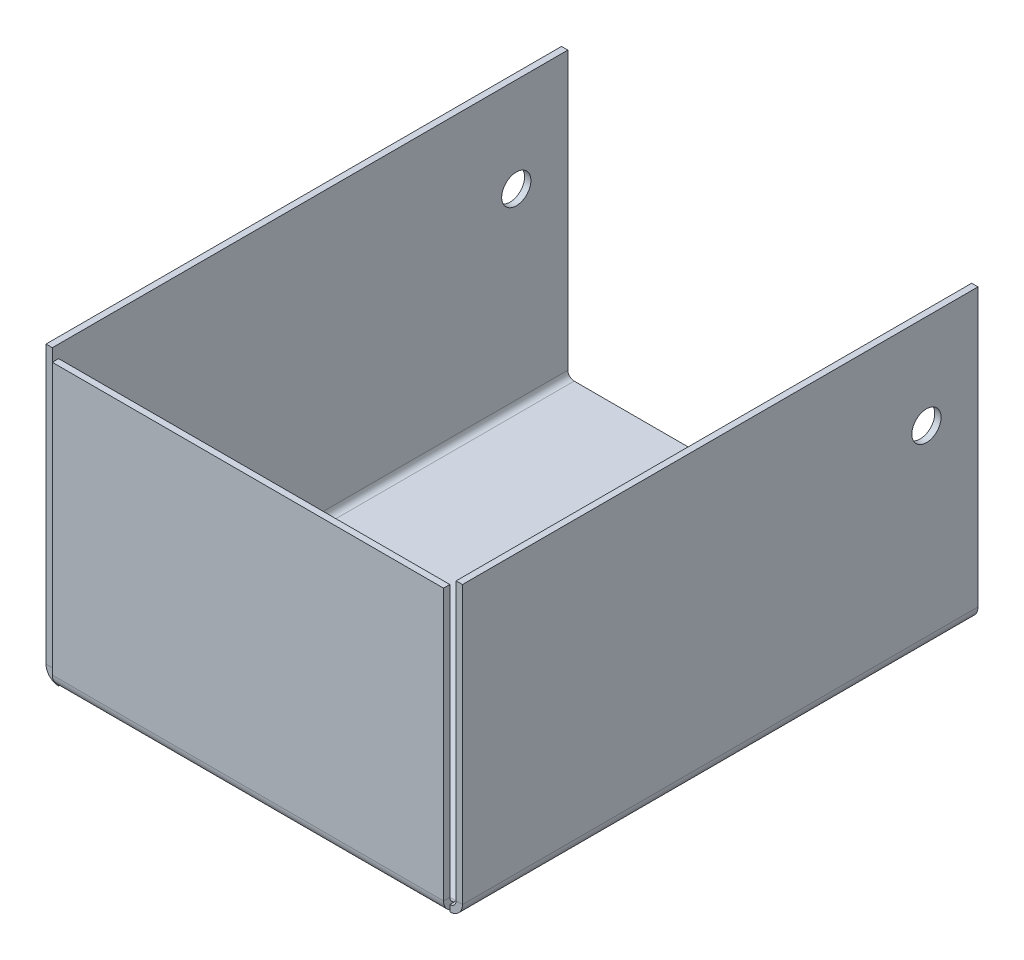
from build123d import *

# Parameters (mm, degrees)
BASE_FLANGE1_DEPTH           = 30
EDGE_FLANGE1_STRIP_W         = 4.4196
EDGE_FLANGE1_STRIP_H         = 0.7366
EDGE_FLANGE1_STRIP_CUT_DEPTH = 45.5268
EDGE_FLANGE1_DEPTH           = 45.5268
M3_CLEARANCE_HOLE1_D         = 3.4
SKETCH13_R                   = 3
CUT_EXTRUDE2_DEPTH           = 52.675037868


# Sheet-metal steps are written as plain solids
with BuildPart() as part:
    # Sketch1 → Base-Flange1 (new, symmetric)
    with BuildSketch(Plane.XY):
        with BuildLine():
            Line((-23.5, 33), (-23.5, 0.7366))
            ThreePointArc((-23.5, 0.7366), (-23.284254855, 0.215745145), (-22.7634, 0))
            Line((-22.7634, 0), (22.7634, 0))
            ThreePointArc((22.7634, 0), (23.284254855, 0.215745145), (23.5, 0.7366))
            Line((23.5, 0.7366), (23.5, 33))
            Line((23.5, 33), (24.2366, 33))
            Line((24.2366, 33), (24.2366, 0.7366))
            ThreePointArc((24.2366, 0.7366), (23.80510971, -0.30510971), (22.7634, -0.7366))
            Line((22.7634, -0.7366), (-22.7634, -0.7366))
            ThreePointArc((-22.7634, -0.7366), (-23.80510971, -0.30510971), (-24.2366, 0.7366))
            Line((-24.2366, 0.7366), (-24.2366, 33))
            Line((-24.2366, 33), (-23.5, 33))
        make_face()
    extrude(amount=BASE_FLANGE1_DEPTH, both=True)

    # Edge-Flange1 strip (across the edge) → Edge-Flange1 strip cut (cut)
    with BuildSketch(Plane(origin=(-22.7634, 0, 30), x_dir=(0, 0, -1), z_dir=(1, 0, 0))):
        with Locations((-1.4732, -0.3683)):
            Rectangle(EDGE_FLANGE1_STRIP_W, EDGE_FLANGE1_STRIP_H)
    extrude(amount=EDGE_FLANGE1_STRIP_CUT_DEPTH, mode=Mode.SUBTRACT)

    # Edge-Flange1 section (across the edge) → Edge-Flange1 (add)
    with BuildSketch(Plane(origin=(-22.7634, 0, 30), x_dir=(0, 0, -1), z_dir=(1, 0, 0))):
        with BuildLine():
            Line((-0.7366, 0.7366), (-0.7366, 32.2634))
            Line((-0.7366, 32.2634), (0, 32.2634))
            Line((0, 32.2634), (0, 0.7366))
            ThreePointArc((0, 0.7366), (0.215745145, 0.215745145), (0.7366, 0))
            Line((0.7366, 0), (0.7366, -0.7366))
            ThreePointArc((0.7366, -0.7366), (-0.30510971, -0.30510971), (-0.7366, 0.7366))
        make_face()
    extrude(amount=EDGE_FLANGE1_DEPTH)

    # M3 Clearance Hole1 (through all)
    with Locations(Plane(origin=(24.2366, 0, 0), x_dir=(0, 0, -1), z_dir=(1, 0, 0))):
        with Locations((24, 22)):
            Hole(M3_CLEARANCE_HOLE1_D / 2)

    # Sketch13 → Cut-Extrude2 (cut, through all)
    with BuildSketch(Plane.XZ.offset(0.7366)):
        with Locations(Location((0, -6.5, 0), (0, 0, 270))):
            Circle(SKETCH13_R)
    extrude(amount=-CUT_EXTRUDE2_DEPTH, mode=Mode.SUBTRACT)


solid = part.part
